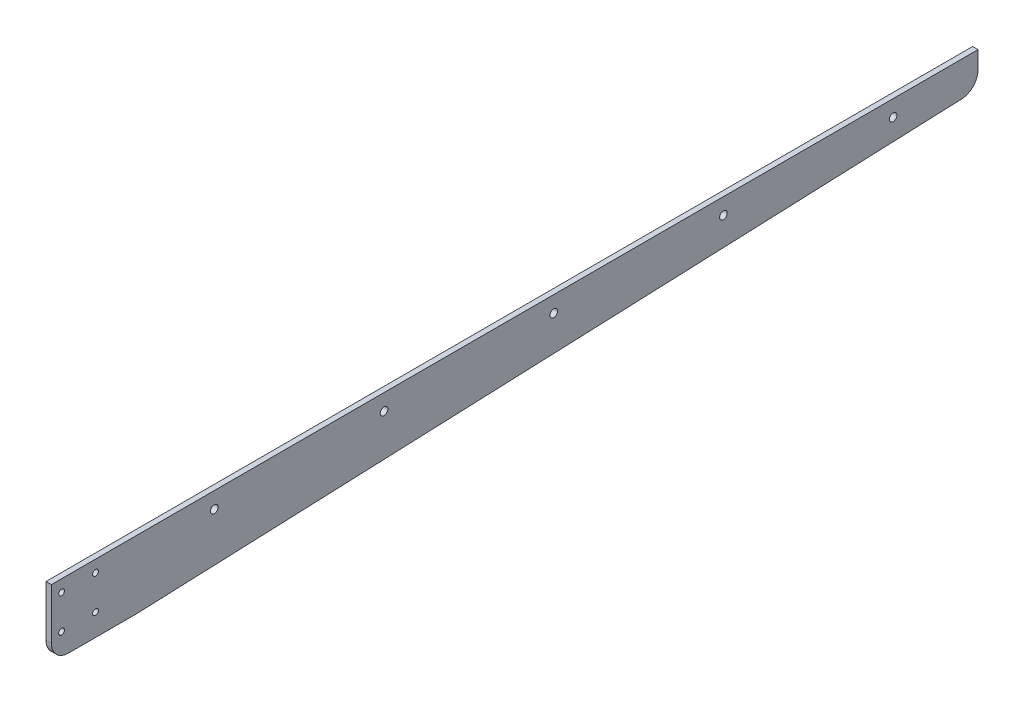
from build123d import *

# Parameters (mm, degrees)
BOSS_EXTRUDE1_DEPTH   = 3.175
M3_CLEARANCE_HOLE1_D  = 3.4
FILLET1_R             = 10
F_8_CLEARANCE_HOLE1_D = 4.4958
LPATTERN1_COUNT       = 5
LPATTERN1_PITCH       = 100


with BuildPart() as part:
    # Sketch1 → Boss-Extrude1 (new body)
    with BuildSketch(Plane(origin=(0, 0, 0), x_dir=(0, 0, -1), z_dir=(1, 0, 0))):
        Polygon((0, 0), (0, 40), (546, 40), (546, 20), (50, 0), align=None)
    extrude(amount=BOSS_EXTRUDE1_DEPTH)

    # M3 Clearance Hole1 (through all)
    with Locations(Plane(origin=(3.175, 33, -26), x_dir=(0, 0, 1), z_dir=(1, 0, 0))):
        with Locations((0, 0), (20, 0), (0, 20), (20, 20)):
            Hole(M3_CLEARANCE_HOLE1_D / 2)

    # Fillet1
    # the kernel refuses this fillet: 10 mm, written as the material it takes off along each edge
    with BuildSketch(Plane(origin=(-25, 0, 0), x_dir=(0, 1, 0), z_dir=(1, 0, 0))) as fillet1_piece_1:
        with BuildLine():
            CenterArc((FILLET1_R, -FILLET1_R), FILLET1_R, 90, 90)
            Line((0, -FILLET1_R), (0, 0))
            Line((0, 0), (FILLET1_R, 0))
        make_face()
    extrude(amount=53.175, mode=Mode.SUBTRACT)
    with BuildSketch(Plane(origin=(-24.012251111, 20, -546), x_dir=(0, -0.04028984011081184, 0.9991880347481376), z_dir=(1, 0, 0))) as fillet1_piece_2:
        with BuildLine():
            CenterArc((FILLET1_R * 0.96049004443, -FILLET1_R), FILLET1_R, 90, 87.690937211)
            Line((-FILLET1_R * 0.0386979903181, -FILLET1_R * 0.959710159889), (0, 0))
            Line((0, 0), (FILLET1_R * 0.96049004443, 0))
        make_face()
    extrude(amount=51.199502222, mode=Mode.SUBTRACT)
    with BuildSketch(Plane(origin=(-0.503827547, 0, -50), x_dir=(0, 0, 1), z_dir=(1, 0, 0))) as fillet1_piece_3:
        with BuildLine():
            CenterArc((FILLET1_R * 0.0201531018646, -FILLET1_R), FILLET1_R, 90, 2.309062789)
            Line((-FILLET1_R * 0.0201367382462, -FILLET1_R * 0.000811965251862), (0, 0))
            Line((0, 0), (FILLET1_R * 0.0201531018646, 0))
        make_face()
    extrude(amount=4.182655093, mode=Mode.SUBTRACT)

    # #8 Clearance Hole1 (through all)
    with Locations(Plane(origin=(3.175, 30.475, -496), x_dir=(0, 0, 1), z_dir=(1, 0, 0))):
        with Locations((0, 0)):
            f_8_clearance_hole1 = Hole(F_8_CLEARANCE_HOLE1_D / 2)

    # LPattern1: #8 Clearance Hole1 ×5
    with Locations(*[(0, 0, i * LPATTERN1_PITCH) for i in range(1, LPATTERN1_COUNT)]):
        add(f_8_clearance_hole1, mode=Mode.SUBTRACT)


solid = part.part
